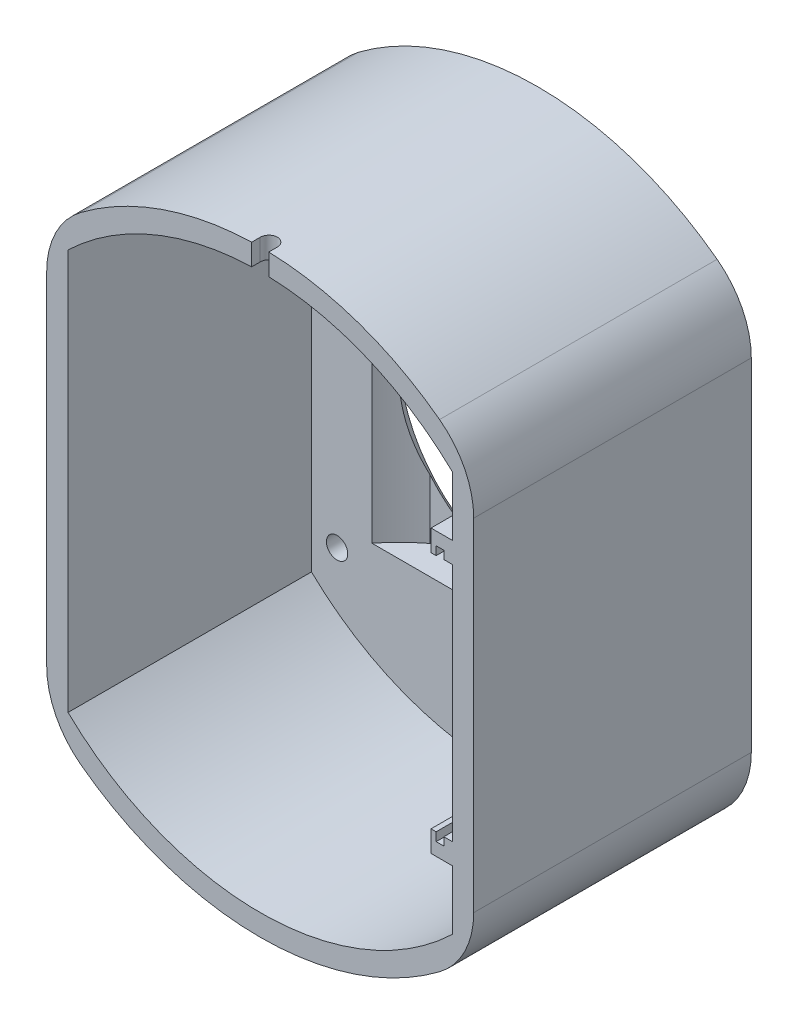
from build123d import *

# Parameters (mm, degrees)
EXTRUDE_2_DEPTH     = 65
SKETCH_1_3_R        = 2.5
BOSS_EXTRUDE1_DEPTH = 8
FILLET1_R           = 20
CHAMFER3_SIZE       = 5
BOSS_EXTRUDE3_DEPTH = 10
BOSS_EXTRUDE4_START = -45
BOSS_EXTRUDE4_DEPTH = 10
CUT_EXTRUDE2_DEPTH  = 108.819293264
SKETCH5_4_R         = 1.1
CUT_EXTRUDE3_DEPTH  = 68
CUT_EXTRUDE4_DEPTH  = 34
CHAMFER4_SIZE       = 2


with BuildPart() as part:
    # Эскиз1 → Extrude 2 (new body)
    with BuildSketch(Plane.XY):
        with BuildLine():
            ThreePointArc((-50, -48.989794856), (0, -70), (50, -48.989794856))
            Line((50, -48.989794856), (50, 48.989794856))
            ThreePointArc((50, 48.989794856), (0, 70), (-50, 48.989794856))
            Line((-50, 48.989794856), (-50, -48.989794856))
        make_face()
        with BuildLine():
            Line((45, -29.057462995), (45, -46.904157598))
            ThreePointArc((45, -46.904157598), (37.452737255, -53.125252678), (29.057462995, -58.143476369))
            ThreePointArc((29.057462995, -58.143476369), (0, -65), (-29.057462995, -58.143476369))
            ThreePointArc((-29.057462995, -58.143476369), (-37.452737255, -53.125252678), (-45, -46.904157598))
            Line((-45, -46.904157598), (-45, -29.057462995))
            Line((-45, -29.057462995), (-45, 29.057462995))
            Line((-45, 29.057462995), (-45, 46.904157598))
            ThreePointArc((-45, 46.904157598), (-37.452737255, 53.125252678), (-29.057462995, 58.143476369))
            ThreePointArc((-29.057462995, 58.143476369), (0, 65), (29.057462995, 58.143476369))
            ThreePointArc((29.057462995, 58.143476369), (37.452737255, 53.125252678), (45, 46.904157598))
            Line((45, 46.904157598), (45, 29.057462995))
            Line((45, 29.057462995), (45, -29.057462995))
        make_face(mode=Mode.SUBTRACT)
    extrude(amount=EXTRUDE_2_DEPTH)

    # Эскиз1<3> → Boss-Extrude1 (add)
    with BuildSketch(Plane.XY):
        with BuildLine():
            Line((45, -46.904157598), (45, 46.904157598))
            ThreePointArc((45, 46.904157598), (0, 65), (-45, 46.904157598))
            Line((-45, 46.904157598), (-45, -46.904157598))
            ThreePointArc((-45, -46.904157598), (0, -65), (45, -46.904157598))
        make_face()
        with Locations((39, -39)):
            Circle(SKETCH_1_3_R, mode=Mode.SUBTRACT)
        with BuildLine():
            Line((27.5, 0.1), (27.5, -0.1))
            ThreePointArc((27.5, -0.1), (19.474725805, -19.474725805), (0.1, -27.5))
            Line((0.1, -27.5), (-0.1, -27.5))
            ThreePointArc((-0.1, -27.5), (-19.474725805, -19.474725805), (-27.5, -0.1))
            Line((-27.5, -0.1), (-27.5, 0.1))
            ThreePointArc((-27.5, 0.1), (-19.474725805, 19.474725805), (-0.1, 27.5))
            Line((-0.1, 27.5), (0.1, 27.5))
            ThreePointArc((0.1, 27.5), (19.474725805, 19.474725805), (27.5, 0.1))
        make_face(mode=Mode.SUBTRACT)
        with Locations((-39, -39)):
            Circle(SKETCH_1_3_R, mode=Mode.SUBTRACT)
        with Locations((-39, 39)):
            Circle(SKETCH_1_3_R, mode=Mode.SUBTRACT)
        with Locations((39, 39)):
            Circle(SKETCH_1_3_R, mode=Mode.SUBTRACT)
    extrude(amount=BOSS_EXTRUDE1_DEPTH)

    # Fillet1
    fillet1_edges = [part.edges().sort_by_distance(p)[0] for p in [
        (50, -48.989794856, 32.5),
        (-50, -48.989794856, 32.5),
        (-50, 48.989794856, 32.5),
        (50, 48.989794856, 32.5),
    ]]
    fillet(fillet1_edges, radius=FILLET1_R)

    # Chamfer3
    chamfer3_edges = [part.edges().sort_by_distance(p)[0] for p in [
        (27.5, 0, 0),
        (19.474725805, 19.474725805, 0),
        (19.474725805, -19.474725805, 0),
        (0, 27.5, 0),
        (0, -27.5, 0),
        (-19.474725805, 19.474725805, 0),
        (-19.474725805, -19.474725805, 0),
        (-27.5, 0, 0),
    ]]
    chamfer(chamfer3_edges, length=CHAMFER3_SIZE)

    # Sketch3 → Boss-Extrude3 (add)
    with BuildSketch(Plane.XY.offset(65)):
        Polygon((41.2, -30), (41.2, -28), (40, -28), (40, -33), (45, -33), (45, -28.104490543), (43, -28.104490543), (43, -30), align=None)
        Polygon((45, 28.104490543), (45, 33), (40, 33), (40, 28), (41.2, 28), (41.2, 30), (43, 30), (43, 28.104490543), align=None)
    extrude(amount=-BOSS_EXTRUDE3_DEPTH)

    # Sketch3<2> → Boss-Extrude4 (add)
    with BuildSketch(Plane.XY.offset(65).offset(BOSS_EXTRUDE4_START)):
        Polygon((41.2, -30), (41.2, -28), (40, -28), (40, -33), (45, -33), (45, -28.104490543), (43, -28.104490543), (43, -30), align=None)
        Polygon((45, 28.104490543), (45, 33), (40, 33), (40, 28), (41.2, 28), (41.2, 30), (43, 30), (43, 28.104490543), align=None)
    extrude(amount=BOSS_EXTRUDE4_DEPTH)

    # Sketch5 → Cut-Extrude2 (cut, through all)
    with BuildSketch(Plane(origin=(0, 0, 0), x_dir=(1, 0, 0), z_dir=(0, 1, 0))):
        with BuildLine():
            ThreePointArc((2, -63), (0, -61), (-2, -63))
            Line((-2, -63), (-2, -65))
            Line((-2, -65), (2, -65))
            Line((2, -65), (2, -63))
        make_face()
    extrude(amount=CUT_EXTRUDE2_DEPTH, mode=Mode.SUBTRACT)

    # Sketch5<4> → Cut-Extrude3 (cut)
    with BuildSketch(Plane(origin=(0, 0, 0), x_dir=(1, 0, 0), z_dir=(0, 1, 0))):
        with Locations((5, -55)):
            Circle(SKETCH5_4_R)
        with Locations((-5, -55)):
            Circle(SKETCH5_4_R)
    extrude(amount=CUT_EXTRUDE3_DEPTH, mode=Mode.SUBTRACT)

    # Sketch6 → Cut-Extrude4 (cut, symmetric)
    with BuildSketch(Plane(origin=(0, 0, 0), x_dir=(1, 0, 0), z_dir=(0, 1, 0))):
        with BuildLine():
            Line((24, -1.25), (-24, -1.25))
            ThreePointArc((-24, -1.25), (-27.636632953, -4.414790031), (-30.859560917, -8))
            Line((-30.859560917, -8), (30.859560917, -8))
            ThreePointArc((30.859560917, -8), (27.636632953, -4.414790031), (24, -1.25))
        make_face()
    extrude(amount=CUT_EXTRUDE4_DEPTH, both=True, mode=Mode.SUBTRACT)

    # Chamfer4
    chamfer4_edges = [part.edges().sort_by_distance(p)[0] for p in [
        (36.5, 39, 0),
        (-41.5, 39, 0),
        (-41.5, -39, 0),
        (36.5, -39, 0),
    ]]
    chamfer(chamfer4_edges, length=CHAMFER4_SIZE)


solid = part.part
